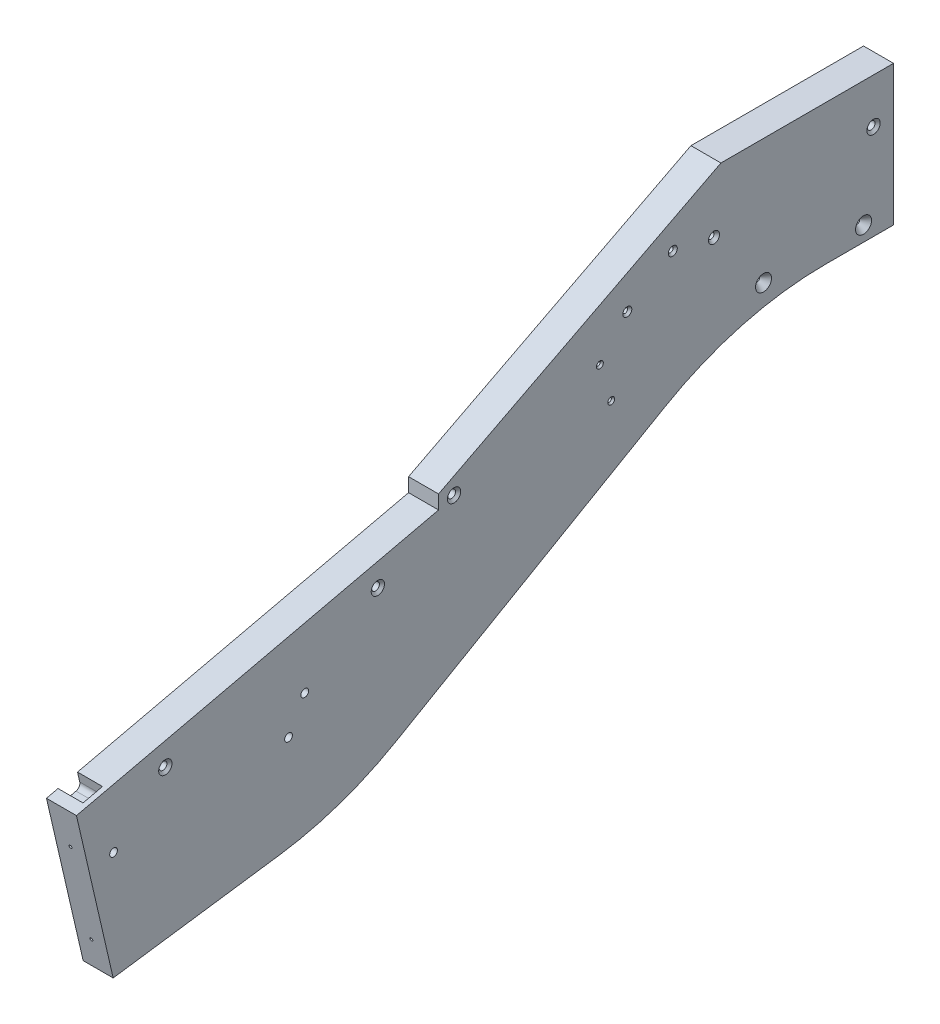
from build123d import *

# Parameters (mm, degrees)
BOSS_EXTRUDE1_START                               = -12.7
BOSS_EXTRUDE1_DEPTH                               = 12.7
CUT_EXTRUDE1_DEPTH                                = 6799.247512927
BOSS_EXTRUDE2_DEPTH                               = 6.35
BOSS_EXTRUDE3_DEPTH                               = 19.05
CUT_EXTRUDE2_REACH                                = 3294.662
SKETCH5_W                                         = 19.05
SKETCH5_H                                         = 70.738300655
F_8_START                                         = 79
F_8_CLEARANCE_HOLE1_OUTLINE_R                     = 2.45745
F_8_CLEARANCE_HOLE1_DEPTH                         = 21
SKETCH22_W                                        = 19.05
SKETCH22_H                                        = 109.611311192
CUT_EXTRUDE3_DEPTH                                = 20.02562
CSK_FOR_8_FLAT_HEAD_MACHINE_SCREW_100_D           = 4.9149
CSK_FOR_8_FLAT_HEAD_MACHINE_SCREW_100_CSINK_D     = 8.4328
CSK_FOR_8_FLAT_HEAD_MACHINE_SCREW_100_CSINK_ANGLE = 100
CUT_EXTRUDE4_DEPTH                                = 6764.722428504
FILLET1_R                                         = 203.2
HOLE6_D                                           = 3.175
HOLE6_DEPTH                                       = 31.75
HOLE6_CSINK_D                                     = 10.16
HOLE6_CSINK_ANGLE                                 = 82
HOLE6_TIP                                         = 0.953866233
CSK_FOR_6_FLAT_HEAD_MACHINE_SCREW1_D              = 3.7973
CSK_FOR_6_FLAT_HEAD_MACHINE_SCREW1_CSINK_D        = 7.0866
CSK_FOR_6_FLAT_HEAD_MACHINE_SCREW1_CSINK_ANGLE    = 82
CSK_FOR_4_FLAT_HEAD_MACHINE_SCREW1_D              = 3.2639
CSK_FOR_4_FLAT_HEAD_MACHINE_SCREW1_CSINK_D        = 5.715
CSK_FOR_4_FLAT_HEAD_MACHINE_SCREW1_CSINK_ANGLE    = 82
CSK_FOR_2_FLAT_HEAD_MACHINE_SCREW1_D              = 2.4384
CSK_FOR_2_FLAT_HEAD_MACHINE_SCREW1_CSINK_D        = 4.3688
CSK_FOR_2_FLAT_HEAD_MACHINE_SCREW1_CSINK_ANGLE    = 82
CUT_EXTRUDE6_DEPTH                                = 15.875


with BuildPart() as part:
    # Boss-Extrude1: read off the stored shape, not the designer's step
    # Boss-Extrude1 outline → Boss-Extrude1 (new body)
    with BuildSketch(Plane(origin=(99.06, 0, 0), x_dir=(0, 0, -1), z_dir=(1, 0, 0)).offset(BOSS_EXTRUDE1_START)):
        Polygon((-3048.635, 5823.580065533), (-3048.635, 5817.939621245), (-3279.272122652, 5764.692845932), (-3270.701487481, 5727.569346464), (-2759.71, 5845.541026859), (-2759.71, 5955.030000144), (-2807.335, 5955.030000144), (-2804.426960815, 5949.385019356), align=None)
    extrude(amount=BOSS_EXTRUDE1_DEPTH)

    # Sketch2 → Cut-Extrude1 (cut, through all)
    with BuildSketch(Plane(origin=(99.06, 0, 0), x_dir=(0, 0, -1), z_dir=(1, 0, 0))):
        Polygon((-3279.272122652, 5764.692845932), (-3048.635, 5817.939621245), (-3048.635, 5814.764621245), (-3278.576208456, 5761.678510384), align=None)
    extrude(amount=-CUT_EXTRUDE1_DEPTH, mode=Mode.SUBTRACT)

    # Sketch3 → Boss-Extrude2 (add)
    with BuildSketch(Plane.ZY.offset(-86.36)):
        Polygon((3278.576208456, 5761.678510384), (3048.635, 5814.764621245), (3048.635, 5823.580065533), (2804.426960815, 5949.385019356), (2807.335, 5955.030000144), (2759.71, 5955.030000144), (2759.71, 5845.541026859), (3270.701487481, 5727.569346464), align=None)
    extrude(amount=BOSS_EXTRUDE2_DEPTH)

    # Sketch4 → Boss-Extrude3 (add, through all)
    with BuildSketch(Plane.ZY.offset(-80.01)):
        Polygon((2759.71, 5845.541026859), (3270.701487481, 5727.569346464), (3252.406488556, 5648.325), (2759.71, 5648.325), align=None)
    extrude(amount=-BOSS_EXTRUDE3_DEPTH)

    # Sketch5 → Cut-Extrude2 (cut, up to next)
    with BuildSketch(Plane(origin=(0, 5935.980000144, 0), x_dir=(1, 0, 0), z_dir=(0, 1, 0)), mode=Mode.PRIVATE) as cut_extrude2_sk1:
        with Locations((89.535, -2795.079150328)):
            Rectangle(SKETCH5_W, SKETCH5_H)
    cut_extrude2_tool1 = extrude(cut_extrude2_sk1.sketch, amount=CUT_EXTRUDE2_REACH, mode=Mode.PRIVATE) & part.part
    add(cut_extrude2_tool1.solids().sort_by_distance((89.535, 5935.98, 2795.07915))[0], mode=Mode.SUBTRACT)

    # #8 Clearance Hole1: read off the stored shape, not the designer's step
    # #8 Clearance Hole1 outline → #8 Clearance Hole1 (cut)
    with BuildSketch(Plane.YZ.offset(F_8_START)):
        with Locations((5737.333926367, 3143.899589677)):
            Circle(F_8_CLEARANCE_HOLE1_OUTLINE_R)
        with Locations((5756.611506802, 3133.589577954)):
            Circle(F_8_CLEARANCE_HOLE1_OUTLINE_R)
        with Locations((5729.634798773, 3255.030012286)):
            Circle(F_8_CLEARANCE_HOLE1_OUTLINE_R)
    extrude(amount=F_8_CLEARANCE_HOLE1_DEPTH, mode=Mode.SUBTRACT)

    # 8 Clearance Hole1 2 outline → 8 Clearance Hole1 2 (revolve, cut)
    with BuildSketch(Plane(origin=(89.535, 6106.319771445, 1409.755000067), x_dir=(1, 0, 0), z_dir=(0, 0.9743700647852487, 0.2249510543438069))):
        Polygon((0.99187, -1879.400856936), (0, -1878.804881314), (0, -1898.450856936), (0.99187, -1898.450856936), align=None)
    revolve(axis=Axis((89.535, 6106.319771445, 1409.755000067), (0, 0.2249510543438069, -0.9743700647852487)), mode=Mode.SUBTRACT)

    # 8 Clearance Hole1 3 outline → 8 Clearance Hole1 3 (revolve, cut)
    with BuildSketch(Plane(origin=(89.535, 6163.988032626, 1423.068767212), x_dir=(1, 0, 0), z_dir=(0, 0.9743700647852487, 0.2249510543438069))):
        Polygon((0.99187, -1879.400856936), (0, -1878.804881314), (0, -1898.450856936), (0.99187, -1898.450856936), align=None)
    revolve(axis=Axis((89.535, 6163.988032626, 1423.068767212), (0, 0.2249510543438069, -0.9743700647852487)), mode=Mode.SUBTRACT)

    # Sketch22 → Cut-Extrude3 (cut)
    with BuildSketch(Plane(origin=(0, 5935.980000144, 0), x_dir=(1, 0, 0), z_dir=(0, 1, 0))):
        with Locations((89.535, -2814.515655596)):
            Rectangle(SKETCH22_W, SKETCH22_H)
    extrude(amount=-CUT_EXTRUDE3_DEPTH, mode=Mode.SUBTRACT)

    # CSK for #8 Flat Head Machine Screw (100)1 (through all)
    with Locations(Plane(origin=(99.06, 0, 0), x_dir=(0, 0, -1), z_dir=(1, 0, 0))):
        with Locations((-3222.137837611, 5760.045015031), (-3087.184948706, 5791.20134438), (-3038.796108056, 5817.934011474), (-2772.41, 5887.379380546)):
            CounterSinkHole(CSK_FOR_8_FLAT_HEAD_MACHINE_SCREW_100_D / 2, CSK_FOR_8_FLAT_HEAD_MACHINE_SCREW_100_CSINK_D / 2, counter_sink_angle=CSK_FOR_8_FLAT_HEAD_MACHINE_SCREW_100_CSINK_ANGLE)

    # Sketch26 → Cut-Extrude4 (cut, through all)
    with BuildSketch(Plane(origin=(99.06, 0, 0), x_dir=(0, 0, -1), z_dir=(1, 0, 0))):
        Polygon((-3252.406488556, 5648.325), (-2759.71, 5648.325), (-2759.71, 5827.054380546), (-2857.340029902, 5827.054380546), (-3110.151425601, 5681.093653185), (-3255.263366946, 5660.699499823), align=None)
    extrude(amount=-CUT_EXTRUDE4_DEPTH, mode=Mode.SUBTRACT)

    # Fillet1
    fillet1_edges = [part.edges().sort_by_distance(p)[0] for p in [
        (89.535, 5681.093653185, 3110.151425601),
        (89.535, 5827.054380546, 2857.340029902),
    ]]
    fillet(fillet1_edges, radius=FILLET1_R)

    # Hole6
    with Locations(Plane(origin=(99.06, 0, 0), x_dir=(0, 0, -1), z_dir=(1, 0, 0))):
        with Locations((-2778.76, 5836.579380546), (-2842.26, 5836.579380546)):
            CounterSinkHole(HOLE6_D / 2, HOLE6_CSINK_D / 2, depth=HOLE6_DEPTH, counter_sink_angle=HOLE6_CSINK_ANGLE)
            with Locations((0, 0, -(HOLE6_DEPTH + HOLE6_TIP / 2))):  # 118° drill point
                Cone(0, HOLE6_D / 2, HOLE6_TIP, mode=Mode.SUBTRACT)

    # CSK for #6 Flat Head Machine Screw1 (through all)
    with Locations(Plane(origin=(99.06, 0, 0), x_dir=(0, 0, -1), z_dir=(1, 0, 0))):
        with Locations((-2873.705975086, 5877.154772353)):
            CounterSinkHole(CSK_FOR_6_FLAT_HEAD_MACHINE_SCREW1_D / 2, CSK_FOR_6_FLAT_HEAD_MACHINE_SCREW1_CSINK_D / 2, counter_sink_angle=CSK_FOR_6_FLAT_HEAD_MACHINE_SCREW1_CSINK_ANGLE)

    # CSK for #4 Flat Head Machine Screw1 (through all)
    with Locations(Plane(origin=(99.06, 0, 0), x_dir=(0, 0, -1), z_dir=(1, 0, 0))):
        with Locations((-2928.787214128, 5863.882760898), (-2899.887388336, 5882.819970608)):
            CounterSinkHole(CSK_FOR_4_FLAT_HEAD_MACHINE_SCREW1_D / 2, CSK_FOR_4_FLAT_HEAD_MACHINE_SCREW1_CSINK_D / 2, counter_sink_angle=CSK_FOR_4_FLAT_HEAD_MACHINE_SCREW1_CSINK_ANGLE)

    # CSK for #2 Flat Head Machine Screw1 (through all)
    with Locations(Plane(origin=(99.06, 0, 0), x_dir=(0, 0, -1), z_dir=(1, 0, 0))):
        with Locations((-2939.003662809, 5819.981482761), (-2946.198895696, 5843.372904772)):
            CounterSinkHole(CSK_FOR_2_FLAT_HEAD_MACHINE_SCREW1_D / 2, CSK_FOR_2_FLAT_HEAD_MACHINE_SCREW1_CSINK_D / 2, counter_sink_angle=CSK_FOR_2_FLAT_HEAD_MACHINE_SCREW1_CSINK_ANGLE)

    # Sketch36 → Cut-Extrude6 (cut)
    with BuildSketch(Plane.ZY.offset(-80.01)):
        with BuildLine():
            Line((3271.237867638, 5763.372699854), (3258.863367816, 5766.229578244))
            Line((3258.863367816, 5766.229578244), (3257.43492862, 5760.042328333))
            ThreePointArc((3257.43492862, 5760.042328333), (3257.836000871, 5757.645615071), (3259.814333979, 5756.23448378))
            Line((3259.814333979, 5756.23448378), (3266.00158389, 5754.806044585))
            ThreePointArc((3266.00158389, 5754.806044585), (3268.398297151, 5755.207116835), (3269.809428443, 5757.185449943))
            Line((3269.809428443, 5757.185449943), (3271.237867638, 5763.372699854))
        make_face()
    extrude(amount=-CUT_EXTRUDE6_DEPTH, mode=Mode.SUBTRACT)


solid = part.part
